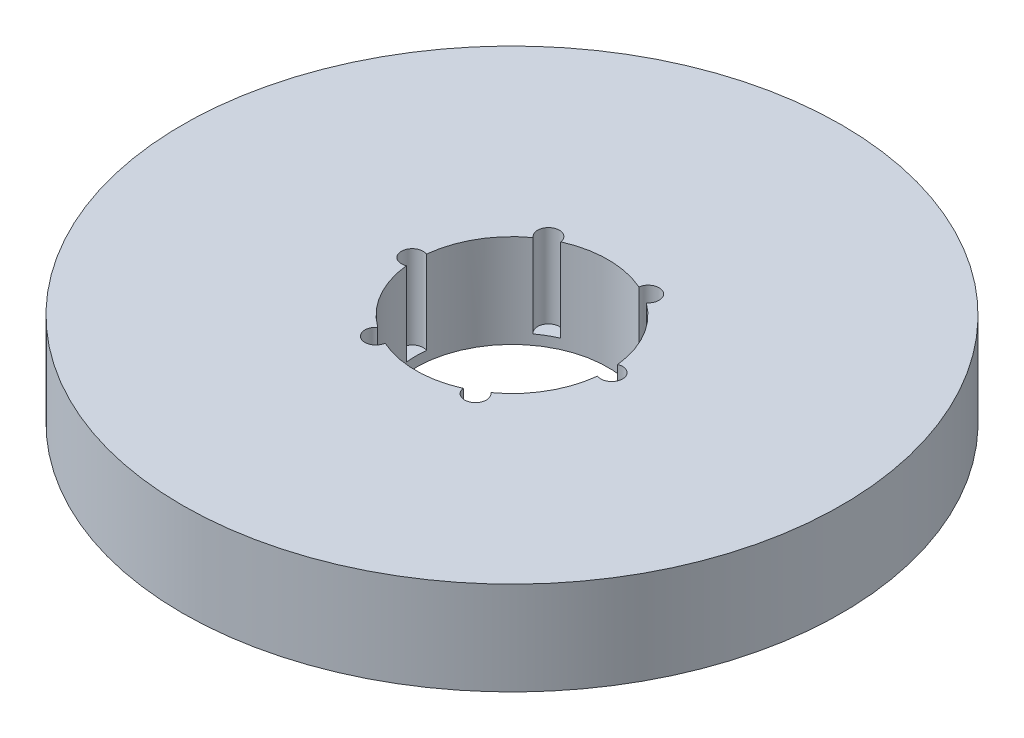
from build123d import *

# Parameters (mm, degrees)
SKETCH1_R           = 60
BOSS_EXTRUDE1_DEPTH = 17
SKETCH2_R           = 17.5
CUT_EXTRUDE1_DEPTH  = 87.539008545
SKETCH3_R           = 1.981221143
CUT_EXTRUDE2_DEPTH  = 15.193658536
CIRPATTERN1_COUNT   = 6


with BuildPart() as part:
    # Sketch1 → Boss-Extrude1 (new body)
    with BuildSketch(Plane(origin=(0, 0, 0), x_dir=(1, 0, 0), z_dir=(0, 1, 0))):
        Circle(SKETCH1_R)
    extrude(amount=BOSS_EXTRUDE1_DEPTH)

    # Sketch2 → Cut-Extrude1 (cut, through all)
    with BuildSketch(Plane(origin=(0, 0, 0), x_dir=(1, 0, 0), z_dir=(0, 1, 0))):
        Circle(SKETCH2_R)
    extrude(amount=CUT_EXTRUDE1_DEPTH, mode=Mode.SUBTRACT)

    # Sketch3 → Cut-Extrude2 (cut)
    with BuildSketch(Plane(origin=(0, 17, 0), x_dir=(1, 0, 0), z_dir=(0, 1, 0))):
        with Locations((-18.154292488, 0)):
            Circle(SKETCH3_R)
    cut_extrude2 = extrude(amount=-CUT_EXTRUDE2_DEPTH, mode=Mode.SUBTRACT)

    # CirPattern1: Cut-Extrude2 ×6 about axis
    cirpattern1_axis = Axis((0, 0, 0), (0, 1, 0))
    for i in range(1, CIRPATTERN1_COUNT):
        add(cut_extrude2.rotate(cirpattern1_axis, i * 360 / CIRPATTERN1_COUNT), mode=Mode.SUBTRACT)


solid = part.part
